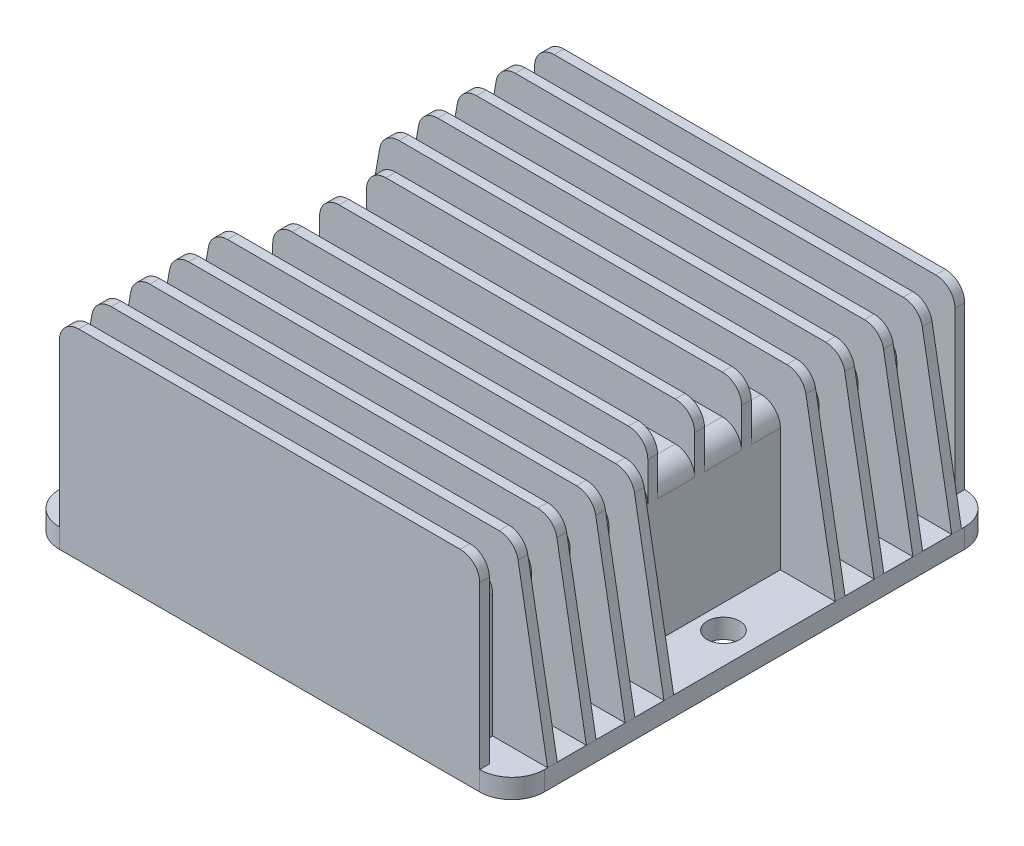
from build123d import *

# Parameters (mm, degrees)
EXTRUDE_1_DEPTH                = 3
SKETCH_2_W                     = 58
SKETCH_2_H                     = 75
EXTRUDE_2_DEPTH                = 22
FILLET_1_R                     = 3
EXTRUDE_3_DEPTH                = 1.5
FILLET_2_R                     = 3
FILLET_2_OF_MIRROR_1_R         = 3
SKETCH_4_R                     = 2.5
CUT_EXTRUDE_1_DEPTH            = 3
EXTRUDE_4_REACH                = 61.971
SKETCH_5_W                     = 75
SKETCH_5_H                     = 1.5
CUT_EXTRUDE_5_DEPTH            = 3
FILLET_4_R                     = 3
PATTERN_LINEAR_1_COUNT         = 4
PATTERN_LINEAR_1_PITCH         = 6
PATTERN_LINEAR_1_COPY_1_DEPTH  = 3
PATTERN_LINEAR_1_COPY_2_DEPTH  = 3
PATTERN_LINEAR_1_COPY_3_DEPTH  = 3
FILLET_4_OF_PATTERN_LINEAR_1_R = 3
MIRROR_START                   = 12.5
MIRROR_4_DEPTH                 = 1.5
MIRROR_START_2                 = 18.5
MIRROR_4_2_DEPTH               = 1.5
MIRROR_START_3                 = 24.5
MIRROR_4_3_DEPTH               = 1.5
MIRROR_START_4                 = 30.5
MIRROR_4_4_DEPTH               = 1.5
EXTRUDE_5_DEPTH                = 6
EXTRUDE_5_DEPTH_BACK           = 3
SKETCH_7_W                     = 52
SKETCH_7_H                     = 1.5
SKETCH_7_W_2                   = 3
FILLET_5_R                     = 3
SKETCH_8_W                     = 32
SKETCH_8_H                     = 16.6
EXTRUDE_6_DEPTH                = 3
FILLET_6_R                     = 0.5
SKETCH_9_R                     = 1.9
EXTRUDE_7_DEPTH                = 5


# Read off the part's stored shape, not the designer's step: ﾐﾗｰ4
with BuildPart() as part:
    # ｽｹｯﾁ1 → ﾎﾞｽ - 押し出し1 (new body)
    with BuildSketch(Plane(origin=(0, 0, 0), x_dir=(1, 0, 0), z_dir=(0, 1, 0))):
        with BuildLine():
            Line((-32.5, -37.5), (32.5, -37.5))
            ThreePointArc((32.5, -37.5), (36.035533906, -36.035533906), (37.5, -32.5))
            Line((37.5, -32.5), (37.5, 32.5))
            ThreePointArc((37.5, 32.5), (36.035533906, 36.035533906), (32.5, 37.5))
            Line((32.5, 37.5), (-32.5, 37.5))
            ThreePointArc((-32.5, 37.5), (-36.035533906, 36.035533906), (-37.5, 32.5))
            Line((-37.5, 32.5), (-37.5, -32.5))
            ThreePointArc((-37.5, -32.5), (-36.035533906, -36.035533906), (-32.5, -37.5))
        make_face()
    extrude(amount=EXTRUDE_1_DEPTH)

    # ｽｹｯﾁ2 → ﾎﾞｽ - 押し出し2 (add)
    with BuildSketch(Plane(origin=(0, 3, 0), x_dir=(1, 0, 0), z_dir=(0, 1, 0))):
        Rectangle(SKETCH_2_W, SKETCH_2_H)
    extrude(amount=EXTRUDE_2_DEPTH)

    # ﾌｨﾚｯﾄ1
    fillet_1_edges = [part.edges().sort_by_distance(p)[0] for p in [
        (29, 25, 0),
        (-29, 25, 0),
    ]]
    fillet(fillet_1_edges, radius=FILLET_1_R)

    # ｽｹｯﾁ3 → ﾎﾞｽ - 押し出し3 (add)
    with BuildSketch(Plane.XY.offset(37.5)):
        with BuildLine():
            Line((32.5, 3), (32.5, 31))
            Line((32.5, 31), (-32.5, 31))
            Line((-32.5, 31), (-32.5, 3))
            Line((-32.5, 3), (-29, 3))
            Line((-29, 3), (-29, 22))
            ThreePointArc((-29, 22), (-28.121320344, 24.121320344), (-26, 25))
            Line((-26, 25), (26, 25))
            ThreePointArc((26, 25), (28.121320344, 24.121320344), (29, 22))
            Line((29, 22), (29, 3))
            Line((29, 3), (32.5, 3))
        make_face()
    extrude_3 = extrude(amount=-EXTRUDE_3_DEPTH)

    # ﾌｨﾚｯﾄ2
    fillet_2_edges = [part.edges().sort_by_distance(p)[0] for p in [
        (-32.5, 31, 36.75),
        (32.5, 31, 36.75),
    ]]
    fillet(fillet_2_edges, radius=FILLET_2_R)

    # ﾐﾗｰ1: ﾎﾞｽ - 押し出し3 across plane
    add(extrude_3.mirror(Plane.XY))

    # ﾌｨﾚｯﾄ2 of ﾐﾗｰ1
    fillet_2_of_mirror_1_edges = [part.edges().sort_by_distance(p)[0] for p in [
        (-32.5, 31, -36.75),
        (32.5, 31, -36.75),
    ]]
    fillet(fillet_2_of_mirror_1_edges, radius=FILLET_2_OF_MIRROR_1_R)

    # ｽｹｯﾁ4 → ｶｯﾄ - 押し出し1 (cut)
    with BuildSketch(Plane(origin=(0, 3, 0), x_dir=(1, 0, 0), z_dir=(0, 1, 0))):
        with Locations(Location((-32.7, 0, 0), (0, 0, 270))):
            Circle(SKETCH_4_R)
    cut_extrude_1 = extrude(amount=-CUT_EXTRUDE_1_DEPTH, mode=Mode.SUBTRACT)

    # ﾐﾗｰ2: ｶｯﾄ - 押し出し1 across plane
    add(cut_extrude_1.mirror(Plane(origin=(0, 0, 0), x_dir=(0, 0, 1), z_dir=(1, 0, 0))), mode=Mode.SUBTRACT)

    # ﾎﾞｽ - 押し出し4: up to this face of the body (flat: up to its plane)
    extrude_4_end = Plane(part.part.faces().sort_by_distance((0, 31, -36.75))[0])
    # ｽｹｯﾁ5 → ﾎﾞｽ - 押し出し4 (add, up to the picked face)
    with BuildSketch(Plane(origin=(0, 3, 0), x_dir=(1, 0, 0), z_dir=(0, 1, 0)), mode=Mode.PRIVATE) as extrude_4_sk1:
        with Locations((0, 31.25)):
            Rectangle(SKETCH_5_W, SKETCH_5_H)
    extrude_4_tool1 = split(extrude(extrude_4_sk1.sketch, amount=EXTRUDE_4_REACH, mode=Mode.PRIVATE), bisect_by=extrude_4_end, keep=Keep.BOTH, mode=Mode.PRIVATE)
    extrude_4 = extrude_4_tool1.solids().sort_by(Axis((0, 3, -31.25), (0, 1, 0)))[0]
    add(extrude_4)

    # ｽｹｯﾁ6 → ｶｯﾄ - 押し出し5 (cut)
    with BuildSketch(Plane(origin=(0, 0, -32), x_dir=(-1, 0, 0), z_dir=(0, 0, -1))):
        Polygon((-37.5, 31), (-37.5, 3), (-32.5, 31), align=None)
    cut_extrude_5 = extrude(amount=-CUT_EXTRUDE_5_DEPTH, mode=Mode.SUBTRACT)

    # ﾐﾗｰ3: ｶｯﾄ - 押し出し5 across plane
    add(cut_extrude_5.mirror(Plane(origin=(0, 0, 0), x_dir=(0, 0, 1), z_dir=(1, 0, 0))), mode=Mode.SUBTRACT)

    # ﾌｨﾚｯﾄ4
    fillet_4_edges = [part.edges().sort_by_distance(p)[0] for p in [
        (32.5, 31, -31.25),
        (-32.5, 31, -31.25),
    ]]
    fillet(fillet_4_edges, radius=FILLET_4_R)

    # 直線ﾊﾟﾀｰﾝ1: ﾎﾞｽ - 押し出し4, ｶｯﾄ - 押し出し5 ×4
    with Locations(*[(0, 0, i * PATTERN_LINEAR_1_PITCH) for i in range(1, PATTERN_LINEAR_1_COUNT)]):
        add(extrude_4)
        add(cut_extrude_5, mode=Mode.SUBTRACT)

    # 直線ﾊﾟﾀｰﾝ1 copy 1 sketch → 直線ﾊﾟﾀｰﾝ1 copy 1 (cut)
    with BuildSketch(Plane(origin=(0, 0, -26), x_dir=(1, 0, 0), z_dir=(0, 0, -1))):
        Polygon((-37.5, -31), (-37.5, -3), (-32.5, -31), align=None)
    extrude(amount=-PATTERN_LINEAR_1_COPY_1_DEPTH, mode=Mode.SUBTRACT)

    # 直線ﾊﾟﾀｰﾝ1 copy 2 sketch → 直線ﾊﾟﾀｰﾝ1 copy 2 (cut)
    with BuildSketch(Plane(origin=(0, 0, -20), x_dir=(1, 0, 0), z_dir=(0, 0, -1))):
        Polygon((-37.5, -31), (-37.5, -3), (-32.5, -31), align=None)
    extrude(amount=-PATTERN_LINEAR_1_COPY_2_DEPTH, mode=Mode.SUBTRACT)

    # 直線ﾊﾟﾀｰﾝ1 copy 3 sketch → 直線ﾊﾟﾀｰﾝ1 copy 3 (cut)
    with BuildSketch(Plane(origin=(0, 0, -14), x_dir=(1, 0, 0), z_dir=(0, 0, -1))):
        Polygon((-37.5, -31), (-37.5, -3), (-32.5, -31), align=None)
    extrude(amount=-PATTERN_LINEAR_1_COPY_3_DEPTH, mode=Mode.SUBTRACT)

    # ﾌｨﾚｯﾄ4 of 直線ﾊﾟﾀｰﾝ1
    fillet_4_of_pattern_linear_1_edges = [part.edges().sort_by_distance(p)[0] for p in [
        (32.5, 31, -25.25),
        (-32.5, 31, -25.25),
        (32.5, 31, -19.25),
        (-32.5, 31, -19.25),
        (32.5, 31, -13.25),
        (-32.5, 31, -13.25),
    ]]
    fillet(fillet_4_of_pattern_linear_1_edges, radius=FILLET_4_OF_PATTERN_LINEAR_1_R)

    # ﾐﾗｰ4 outline → ﾐﾗｰ4 (add)
    with BuildSketch(Plane.XY.offset(MIRROR_START)):
        with BuildLine():
            ThreePointArc((32.941540729, 28.527371915), (31.914119402, 30.300229961), (29.988258003, 31))
            Line((29.988258003, 31), (-29.988258003, 31))
            ThreePointArc((-29.988258003, 31), (-31.914119402, 30.300229961), (-32.941540729, 28.527371915))
            Line((-32.941540729, 28.527371915), (-37.5, 3))
            Line((-37.5, 3), (-29, 3))
            Line((-29, 3), (-29, 22))
            ThreePointArc((-29, 22), (-28.121320344, 24.121320344), (-26, 25))
            Line((-26, 25), (26, 25))
            ThreePointArc((26, 25), (28.121320344, 24.121320344), (29, 22))
            Line((29, 22), (29, 3))
            Line((29, 3), (37.5, 3))
            Line((37.5, 3), (32.941540729, 28.527371915))
        make_face()
    extrude(amount=MIRROR_4_DEPTH)

    # Mirror 4 2 outline → Mirror 4 2 (add)
    with BuildSketch(Plane.XY.offset(MIRROR_START_2)):
        with BuildLine():
            ThreePointArc((32.941540729, 28.527371915), (31.914119402, 30.300229961), (29.988258003, 31))
            Line((29.988258003, 31), (-29.988258003, 31))
            ThreePointArc((-29.988258003, 31), (-31.914119402, 30.300229961), (-32.941540729, 28.527371915))
            Line((-32.941540729, 28.527371915), (-37.5, 3))
            Line((-37.5, 3), (-29, 3))
            Line((-29, 3), (-29, 22))
            ThreePointArc((-29, 22), (-28.121320344, 24.121320344), (-26, 25))
            Line((-26, 25), (26, 25))
            ThreePointArc((26, 25), (28.121320344, 24.121320344), (29, 22))
            Line((29, 22), (29, 3))
            Line((29, 3), (37.5, 3))
            Line((37.5, 3), (32.941540729, 28.527371915))
        make_face()
    extrude(amount=MIRROR_4_2_DEPTH)

    # Mirror 4 3 outline → Mirror 4 3 (add)
    with BuildSketch(Plane.XY.offset(MIRROR_START_3)):
        with BuildLine():
            ThreePointArc((32.941540729, 28.527371915), (31.914119402, 30.300229961), (29.988258003, 31))
            Line((29.988258003, 31), (-29.988258003, 31))
            ThreePointArc((-29.988258003, 31), (-31.914119402, 30.300229961), (-32.941540729, 28.527371915))
            Line((-32.941540729, 28.527371915), (-37.5, 3))
            Line((-37.5, 3), (-29, 3))
            Line((-29, 3), (-29, 22))
            ThreePointArc((-29, 22), (-28.121320344, 24.121320344), (-26, 25))
            Line((-26, 25), (26, 25))
            ThreePointArc((26, 25), (28.121320344, 24.121320344), (29, 22))
            Line((29, 22), (29, 3))
            Line((29, 3), (37.5, 3))
            Line((37.5, 3), (32.941540729, 28.527371915))
        make_face()
    extrude(amount=MIRROR_4_3_DEPTH)

    # Mirror 4 4 outline → Mirror 4 4 (add)
    with BuildSketch(Plane.XY.offset(MIRROR_START_4)):
        with BuildLine():
            ThreePointArc((32.941540729, 28.527371915), (31.914119402, 30.300229961), (29.988258003, 31))
            Line((29.988258003, 31), (-29.988258003, 31))
            ThreePointArc((-29.988258003, 31), (-31.914119402, 30.300229961), (-32.941540729, 28.527371915))
            Line((-32.941540729, 28.527371915), (-37.5, 3))
            Line((-37.5, 3), (-29, 3))
            Line((-29, 3), (-29, 22))
            ThreePointArc((-29, 22), (-28.121320344, 24.121320344), (-26, 25))
            Line((-26, 25), (26, 25))
            ThreePointArc((26, 25), (28.121320344, 24.121320344), (29, 22))
            Line((29, 22), (29, 3))
            Line((29, 3), (37.5, 3))
            Line((37.5, 3), (32.941540729, 28.527371915))
        make_face()
    extrude(amount=MIRROR_4_4_DEPTH)

    # ｽｹｯﾁ7 → ﾎﾞｽ - 押し出し5 (add, two sides: drawn at the far end of the back side and taken through both)
    with BuildSketch(Plane(origin=(0, 25, 0), x_dir=(1, 0, 0), z_dir=(0, 1, 0)).offset(-EXTRUDE_5_DEPTH_BACK)):
        with Locations((0, 7.25)):
            Rectangle(SKETCH_7_W, SKETCH_7_H)
        Rectangle(SKETCH_7_W, SKETCH_7_H)
        with Locations((0, -7.25)):
            Rectangle(SKETCH_7_W, SKETCH_7_H)
        with Locations((-27.5, 7.25)):
            Rectangle(SKETCH_7_W_2, SKETCH_7_H)
        with Locations((-27.5, 0)):
            Rectangle(SKETCH_7_W_2, SKETCH_7_H)
        with Locations((-27.5, -7.25)):
            Rectangle(SKETCH_7_W_2, SKETCH_7_H)
        with Locations((27.5, 7.25)):
            Rectangle(SKETCH_7_W_2, SKETCH_7_H)
        with Locations((27.5, 0)):
            Rectangle(SKETCH_7_W_2, SKETCH_7_H)
        with Locations((27.5, -7.25)):
            Rectangle(SKETCH_7_W_2, SKETCH_7_H)
    extrude(amount=EXTRUDE_5_DEPTH + EXTRUDE_5_DEPTH_BACK)

    # ﾌｨﾚｯﾄ5
    fillet_5_edges = [part.edges().sort_by_distance(p)[0] for p in [
        (29, 31, -7.25),
        (-29, 31, -7.25),
        (29, 31, 0),
        (-29, 31, 0),
        (-29, 31, 7.25),
        (29, 31, 7.25),
    ]]
    fillet(fillet_5_edges, radius=FILLET_5_R)

    # ｽｹｯﾁ8 → ﾎﾞｽ - 押し出し6 (add)
    with BuildSketch(Plane(origin=(0, 0, -37.5), x_dir=(-1, 0, 0), z_dir=(0, 0, -1))):
        with Locations((0, 8.3)):
            Rectangle(SKETCH_8_W, SKETCH_8_H)
    extrude(amount=EXTRUDE_6_DEPTH)

    # ﾌｨﾚｯﾄ6
    fillet_6_edges = [part.edges().sort_by_distance(p)[0] for p in [
        (-16, 0, -39),
        (-16, 16.6, -39),
        (16, 16.6, -39),
        (16, 0, -39),
    ]]
    fillet(fillet_6_edges, radius=FILLET_6_R)

    # ｽｹｯﾁ9 → ﾎﾞｽ - 押し出し7 (add)
    with BuildSketch(Plane(origin=(0, 0, -40.5), x_dir=(-1, 0, 0), z_dir=(0, 0, -1))):
        with Locations((3.15, 6.9)):
            Circle(SKETCH_9_R)
        with Locations((9.45, 6.9)):
            Circle(SKETCH_9_R)
    extrude_7 = extrude(amount=EXTRUDE_7_DEPTH)

    # ﾐﾗｰ5: ﾎﾞｽ - 押し出し7 across plane
    add(extrude_7.mirror(Plane(origin=(0, 0, 0), x_dir=(0, 0, 1), z_dir=(1, 0, 0))))


solid = part.part
